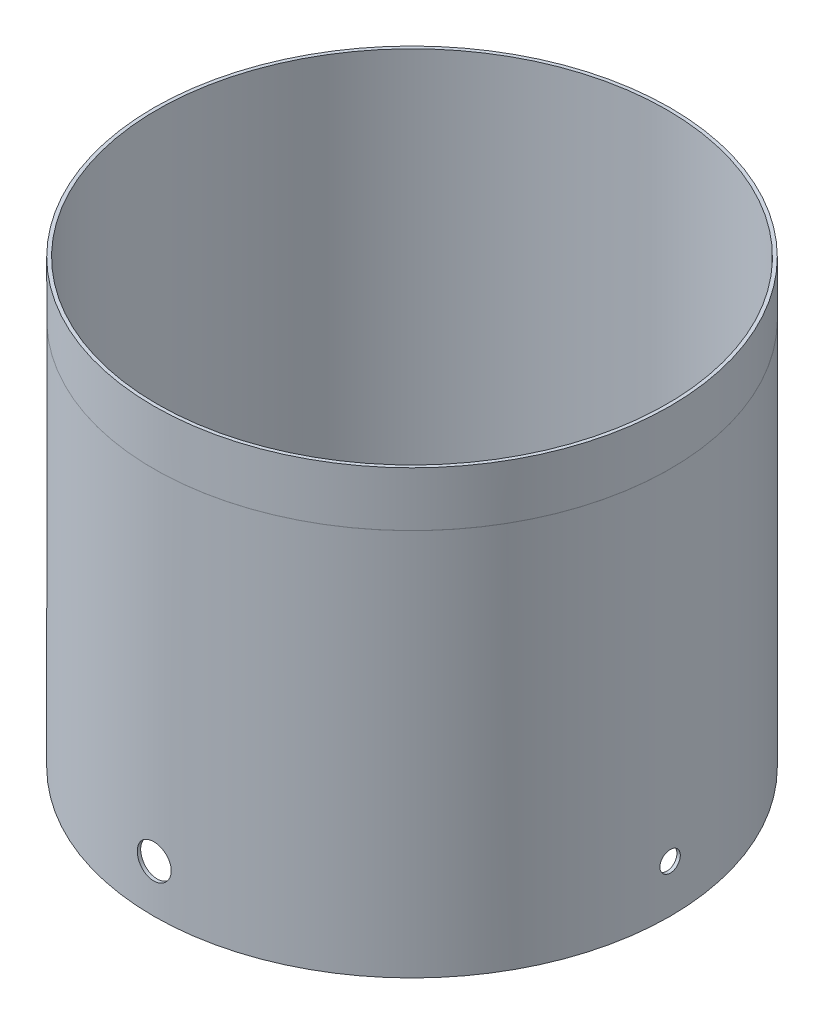
from build123d import *

# Parameters (mm, degrees)
SKETCH1_R               = 38
SKETCH1_R_2             = 37.5
BOSS_EXTRUDE1_DEPTH     = 65
CUT_EXTRUDE1_DEPTH      = 85.338603261
CUT_EXTRUDE1_DEPTH_BACK = 85.338603261
SKETCH2_R               = 1.5
CUT_EXTRUDE2_DEPTH      = 85.338603429
CUT_EXTRUDE2_DEPTH_BACK = 85.338603429
SKETCH4_R               = 2.5


with BuildPart() as part:
    # Sketch1 → Boss-Extrude1 (new body)
    with BuildSketch(Plane(origin=(0, 0, 0), x_dir=(1, 0, 0), z_dir=(0, 1, 0))):
        Circle(SKETCH1_R)
        Circle(SKETCH1_R_2, mode=Mode.SUBTRACT)
    extrude(amount=BOSS_EXTRUDE1_DEPTH)

    # Sketch2 → Cut-Extrude1 (cut, two sides: drawn at the far end of the back side and taken through both)
    with BuildSketch(Plane(origin=(0, 0, 0), x_dir=(0, 0, -1), z_dir=(1, 0, 0)).offset(-CUT_EXTRUDE1_DEPTH_BACK)):
        with Locations((0, 7)):
            Circle(SKETCH2_R)
    extrude(amount=CUT_EXTRUDE1_DEPTH + CUT_EXTRUDE1_DEPTH_BACK, mode=Mode.SUBTRACT)

    # Sketch4 → Cut-Extrude2 (cut, two sides: drawn at the far end of the back side and taken through both)
    with BuildSketch(Plane.XY.offset(-CUT_EXTRUDE2_DEPTH_BACK)):
        with Locations((0, 7)):
            Circle(SKETCH4_R)
    extrude(amount=CUT_EXTRUDE2_DEPTH + CUT_EXTRUDE2_DEPTH_BACK, mode=Mode.SUBTRACT)


solid = part.part
